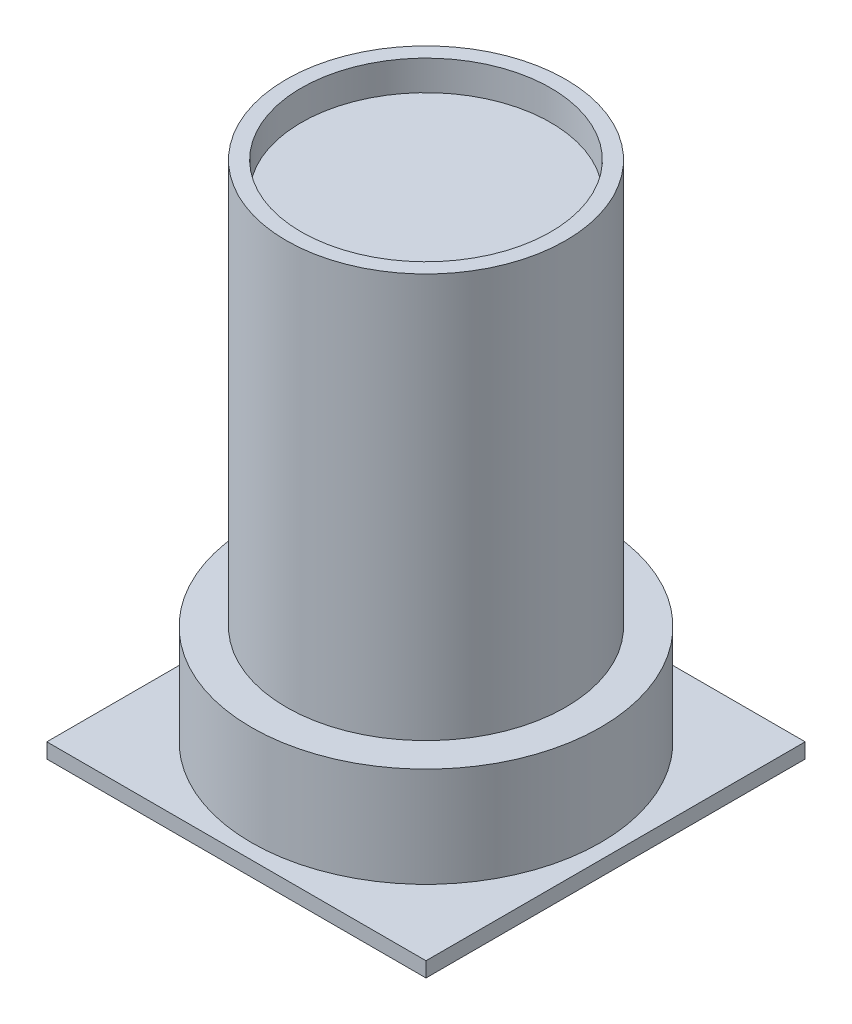
from build123d import *

# Parameters (mm, degrees)
SKETCH1_W           = 38
SKETCH1_H           = 38
BOSS_EXTRUDE1_DEPTH = 1.5
SKETCH2_R           = 17.5
BOSS_EXTRUDE2_DEPTH = 10
SKETCH3_R           = 14
BOSS_EXTRUDE3_DEPTH = 40.5
SKETCH4_R           = 12.5
CUT_EXTRUDE1_DEPTH  = 3


with BuildPart() as part:
    # Sketch1 → Boss-Extrude1 (new body)
    with BuildSketch(Plane(origin=(0, 0, 0), x_dir=(1, 0, 0), z_dir=(0, 1, 0))):
        with Locations((-5.358974359, 7.185897436)):
            Rectangle(SKETCH1_W, SKETCH1_H)
    extrude(amount=BOSS_EXTRUDE1_DEPTH)

    # Sketch2 → Boss-Extrude2 (add)
    with BuildSketch(Plane(origin=(0, 1.5, 0), x_dir=(1, 0, 0), z_dir=(0, 1, 0))):
        with Locations((-5.358974359, 7.185897436)):
            Circle(SKETCH2_R)
    extrude(amount=BOSS_EXTRUDE2_DEPTH)

    # Sketch3 → Boss-Extrude3 (add)
    with BuildSketch(Plane(origin=(0, 11.5, 0), x_dir=(1, 0, 0), z_dir=(0, 1, 0))):
        with Locations((-5.358974359, 7.185897436)):
            Circle(SKETCH3_R)
    extrude(amount=BOSS_EXTRUDE3_DEPTH)

    # Sketch4 → Cut-Extrude1 (cut)
    with BuildSketch(Plane(origin=(0, 52, 0), x_dir=(1, 0, 0), z_dir=(0, 1, 0))):
        with Locations((-5.358974359, 7.185897436)):
            Circle(SKETCH4_R)
    extrude(amount=-CUT_EXTRUDE1_DEPTH, mode=Mode.SUBTRACT)


solid = part.part
